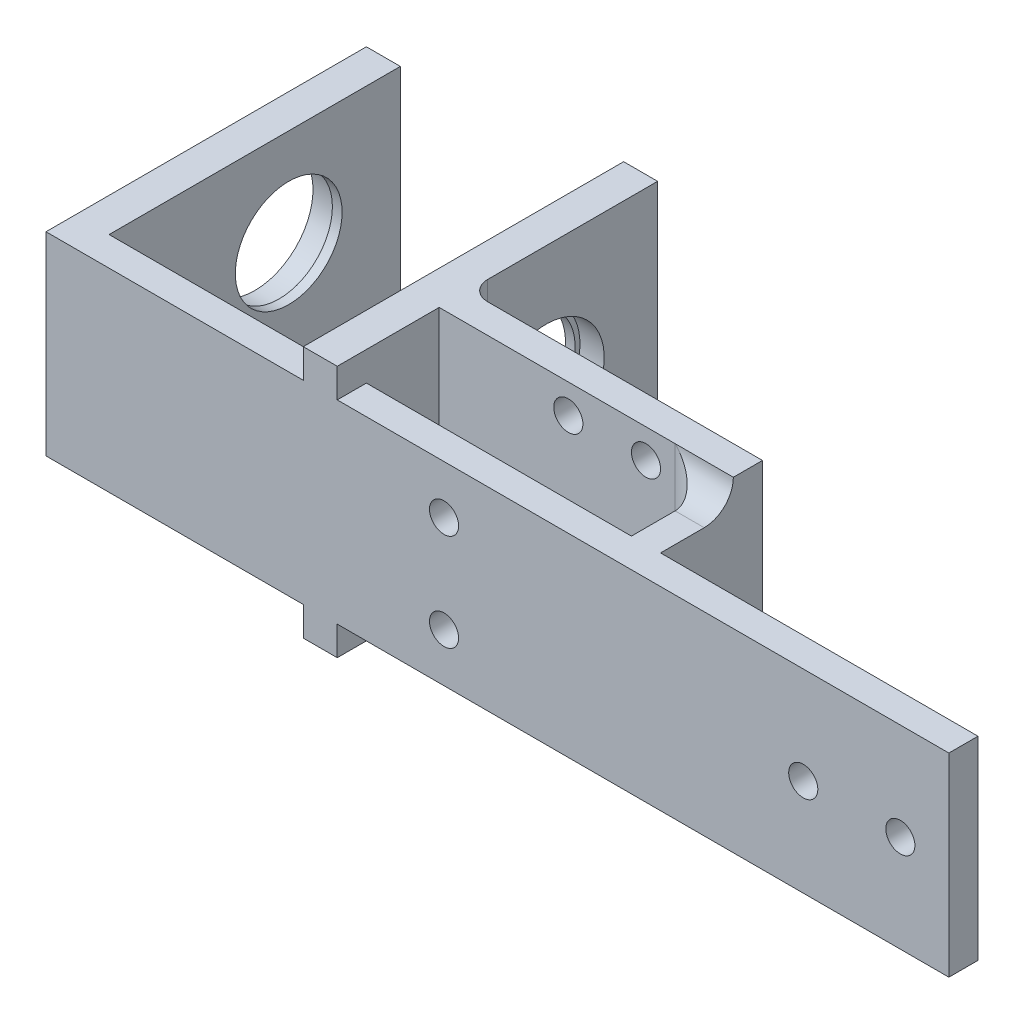
from build123d import *

# Parameters (mm, degrees)
SKETCH_1_W          = 20
SKETCH_1_H          = 20
SKETCH_1_R          = 1.5
SKETCH_1_W_2        = 23
SKETCH_1_W_3        = 3.5
EXTRUDE_1_DEPTH     = 3
EXTRUDE_2_DEPTH     = 30
SKETCH_1_4_W        = 3.5
SKETCH_1_4_H        = 20
EXTRUDE_3_DEPTH     = 30
SKETCH_3_R          = 6
CUT_EXTRUDE_2_DEPTH = 38
SKETCH_4_R          = 6
SKETCH_4_R_2        = 5.5
EXTRUDE_4_DEPTH     = 1
EXTRUDE_START       = -1
SKETCH_5_R          = 6
SKETCH_5_R_2        = 5.5
EXTRUDE_5_DEPTH     = 1
SKETCH_7_R          = 1.5
CUT_EXTRUDE_4_DEPTH = 5
SKETCH_9_W          = 3
SKETCH_9_H          = 26
EXTRUDE_6_DEPTH     = 30.3
SKETCH_10_R         = 1.5
CUT_EXTRUDE_6_DEPTH = 10
FILLET_2_R          = 2
SKETCH_13_W         = 3
SKETCH_13_H         = 20
EXTRUDE_8_DEPTH     = 10.5
FILLET_5_R          = 3


with BuildPart() as part:
    # 草图1 → 凸台-拉伸1 (new body)
    # profile 1 of 5: a face of its own
    with BuildSketch(Plane.XY):
        Polygon((-10, -10.145751311), (-10, 9.854248689), (-53, 9.854248689), (-53, -0.145751311), (-53, -10.145751311), align=None)
    # profile 2 of 5: a face of its own
    with BuildSketch(Plane.XY):
        with Locations((0, -0.145751311)):
            Rectangle(SKETCH_1_W, SKETCH_1_H)
        with Locations((-5, -0.145751311)):
            Circle(SKETCH_1_R, mode=Mode.SUBTRACT)
        with Locations((5, -0.145751311)):
            Circle(SKETCH_1_R, mode=Mode.SUBTRACT)
    # profile 3 of 5: a face of its own
    with BuildSketch(Plane.XY):
        Polygon((-53, -0.145751311), (-53, 9.854248689), (-53, 12.854248689), (-56.5, 12.854248689), (-56.5, 9.854248689), (-56.5, -10.145751311), (-56.5, -13.145751311), (-53, -13.145751311), (-53, -10.145751311), align=None)
    # profile 4 of 5: a face of its own
    with BuildSketch(Plane.XY):
        with Locations((-68, -0.145751311)):
            Rectangle(SKETCH_1_W_2, SKETCH_1_H)
    # profile 5 of 5: a face of its own
    with BuildSketch(Plane.XY):
        with Locations((-81.25, -0.145751311)):
            Rectangle(SKETCH_1_W_3, SKETCH_1_H)
    extrude(amount=EXTRUDE_1_DEPTH)

    # 草图1<3> → 凸台-拉伸2 (add)
    with BuildSketch(Plane.XY):
        Polygon((-53, -0.145751311), (-53, 9.854248689), (-53, 12.854248689), (-56.5, 12.854248689), (-56.5, 9.854248689), (-56.5, -10.145751311), (-56.5, -13.145751311), (-53, -13.145751311), (-53, -10.145751311), align=None)
    extrude(amount=-EXTRUDE_2_DEPTH)

    # 草图1<4> → 凸台-拉伸3 (add)
    with BuildSketch(Plane.XY):
        with Locations((-81.25, -0.145751311)):
            Rectangle(SKETCH_1_4_W, SKETCH_1_4_H)
    extrude(amount=-EXTRUDE_3_DEPTH)

    # 草图3 → 切除-拉伸2 (cut)
    with BuildSketch(Plane.ZY.offset(83)):
        with Locations((-18.5, -0.145751311)):
            Circle(SKETCH_3_R)
    extrude(amount=-CUT_EXTRUDE_2_DEPTH, mode=Mode.SUBTRACT)

    # 草图4 → 凸台-拉伸4 (add)
    with BuildSketch(Plane.ZY.offset(56.5)):
        with Locations((-18.5, -0.145751311)):
            Circle(SKETCH_4_R)
        with Locations((-18.5, -0.145751311)):
            Circle(SKETCH_4_R_2, mode=Mode.SUBTRACT)
    extrude(amount=-EXTRUDE_4_DEPTH)

    # 草图5 → 凸台-拉伸5 (add)
    with BuildSketch(Plane(origin=(-79.5, 0, 0), x_dir=(0, 0, -1), z_dir=(1, 0, 0)).offset(EXTRUDE_START)):
        with Locations(Location((18.5, -0.145751311, 0), (0, 0, 180))):
            Circle(SKETCH_5_R)
        with Locations(Location((18.5, -0.145751311, 0), (0, 0, 180))):
            Circle(SKETCH_5_R_2, mode=Mode.SUBTRACT)
    extrude(amount=EXTRUDE_5_DEPTH)

    # 草图7 → 切除-拉伸4 (cut)
    with BuildSketch(Plane.XY.offset(3)):
        with Locations((-42, 4.853948946)):
            Circle(SKETCH_7_R)
        with Locations((-42, -5.146051054)):
            Circle(SKETCH_7_R)
    extrude(amount=-CUT_EXTRUDE_4_DEPTH, mode=Mode.SUBTRACT)

    # 草图9 → 凸台-拉伸6 (add)
    with BuildSketch(Plane(origin=(-53, 0, 0), x_dir=(0, 0, -1), z_dir=(1, 0, 0))):
        with Locations((9, -0.145751311)):
            Rectangle(SKETCH_9_W, SKETCH_9_H)
    extrude(amount=EXTRUDE_6_DEPTH)

    # 草图10 → 切除-拉伸6 (cut)
    with BuildSketch(Plane.XY.offset(-7.5)):
        with Locations((-31.699132707, 9.854844931)):
            Circle(SKETCH_10_R)
        with Locations((-39.699132705, 9.855007549)):
            Circle(SKETCH_10_R)
        with Locations((-31.699403758, -10.146618604)):
            Circle(SKETCH_10_R)
        with Locations((-39.699403758, -10.146618604)):
            Circle(SKETCH_10_R)
    extrude(amount=-CUT_EXTRUDE_6_DEPTH, mode=Mode.SUBTRACT)

    # 圆角2
    fillet_2_edges = [part.edges().sort_by_distance(p)[0] for p in [
        (-53, -0.145751311, -10.5),
    ]]
    fillet(fillet_2_edges, radius=FILLET_2_R - 0.0001)  # a hair under: the kernel refuses the full size

    # 草图13 → 凸台-拉伸8 (add)
    with BuildSketch(Plane(origin=(0, 0, -10.5), x_dir=(-1, 0, 0), z_dir=(0, 0, -1))):
        with Locations((24.2, -0.145751311)):
            Rectangle(SKETCH_13_W, SKETCH_13_H)
    extrude(amount=-EXTRUDE_8_DEPTH)

    # 圆角5
    fillet_5_edges = [part.edges().sort_by_distance(p)[0] for p in [
        (-24.2, 9.854248689, -7.5),
        (-25.7, -0.145751311, -7.5),
        (-24.2, -10.145751311, -7.5),
    ]]
    fillet(fillet_5_edges, radius=FILLET_5_R - 0.0001)  # a hair under: the kernel refuses the full size


solid = part.part
